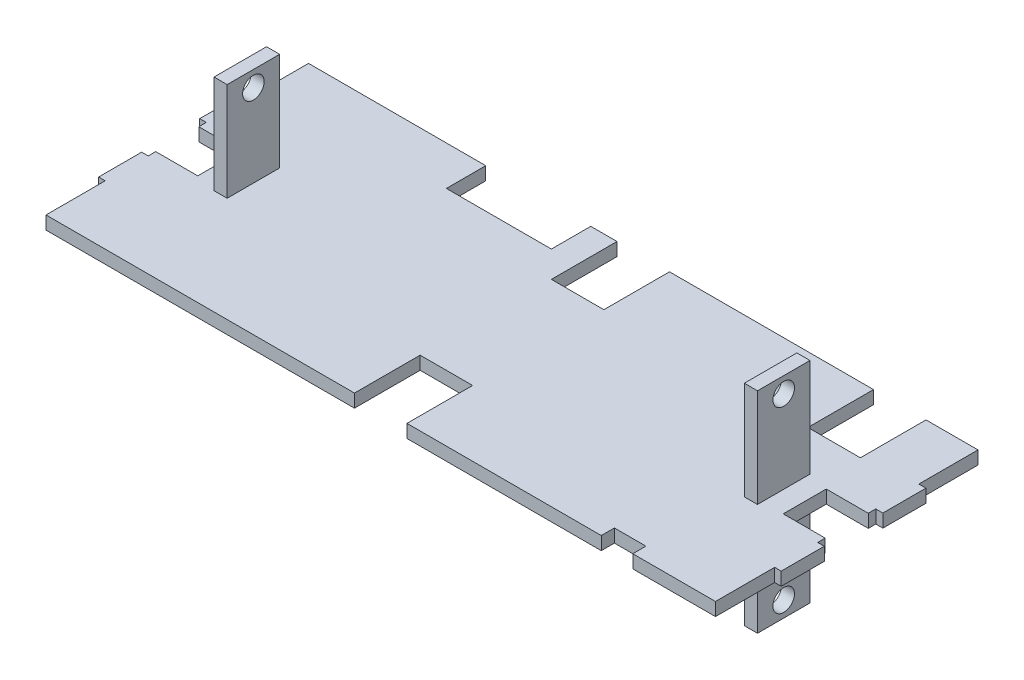
from build123d import *

# Parameters (mm, degrees)
BOSS_EXTRUDE1_DEPTH     = 3.175
SKETCH2_W               = 6.35
SKETCH2_H               = 25.4
BOSS_EXTRUDE2_DEPTH     = 50.8
CUT_EXTRUDE1_DEPTH      = 308.737772139
CUT_EXTRUDE1_DEPTH_BACK = 308.737772139
SKETCH3_R               = 5.207
SKETCH4_W               = 50.8
SKETCH4_H               = 19.05
CUT_EXTRUDE2_DEPTH      = 186.168830911


with BuildPart() as part:
    # Sketch1 → Boss-Extrude1 (new, symmetric)
    with BuildSketch(Plane(origin=(0, 0, 0), x_dir=(1, 0, 0), z_dir=(0, 1, 0))):
        Polygon((-136.779, 63.5), (-111.379, 63.5), (-12.7, 63.5), (-12.7, 31.75), (12.7, 31.75), (12.7, 63.5), (111.379, 63.5), (111.379, 31.75), (136.779, 31.75), (136.779, 63.5), (161.925, 63.5), (161.925, 34.874677354), (165.354, 34.874677354), (165.354, 14.046677354), (161.925, 14.046677354), (161.925, 10.414), (141.605, 10.414), (141.605, -10.414), (161.925, -10.414), (161.925, -14.046677354), (165.1, -14.046677354), (165.1, -34.874677354), (161.925, -34.874677354), (161.925, -63.5), (121.92, -63.5), (121.92, -57.15), (106.68, -57.15), (106.68, -63.5), (12.7, -63.5), (12.7, -31.75), (-12.7, -31.75), (-12.7, -63.5), (-106.68, -63.5), (-110.5408, -63.5), (-135.9408, -63.5), (-161.925, -63.5), (-161.925, -34.874677354), (-165.1, -34.874677354), (-165.1, -14.046677354), (-161.925, -14.046677354), (-161.925, -10.414), (-141.605, -10.414), (-141.605, 10.414), (-161.925, 10.414), (-161.925, 14.046677354), (-165.1, 14.046677354), (-165.1, 34.874677354), (-161.925, 34.874677354), (-161.925, 63.5), align=None)
    extrude(amount=BOSS_EXTRUDE1_DEPTH, both=True)

    # Sketch2 → Boss-Extrude2 (add, symmetric)
    with BuildSketch(Plane(origin=(0, 0, 0), x_dir=(1, 0, 0), z_dir=(0, 1, 0))):
        with Locations((128.27, 0)):
            Rectangle(SKETCH2_W, SKETCH2_H)
        with Locations((-128.27, 0)):
            Rectangle(SKETCH2_W, SKETCH2_H)
    extrude(amount=BOSS_EXTRUDE2_DEPTH, both=True)

    # Sketch3 → Cut-Extrude1 (cut, two sides: drawn at the far end of the back side and taken through both)
    with BuildSketch(Plane.ZY.offset(131.445).offset(-CUT_EXTRUDE1_DEPTH_BACK)):
        with Locations((0, 43.18)):
            Circle(SKETCH3_R)
        with Locations((0, -43.18)):
            Circle(SKETCH3_R)
    extrude(amount=CUT_EXTRUDE1_DEPTH + CUT_EXTRUDE1_DEPTH_BACK, mode=Mode.SUBTRACT)

    # Sketch4 → Cut-Extrude2 (cut, through all)
    with BuildSketch(Plane(origin=(0, 3.175, 0), x_dir=(1, 0, 0), z_dir=(0, 1, 0))):
        with Locations((-50.8, 53.975)):
            Rectangle(SKETCH4_W, SKETCH4_H)
    extrude(amount=-CUT_EXTRUDE2_DEPTH, mode=Mode.SUBTRACT)


solid = part.part
